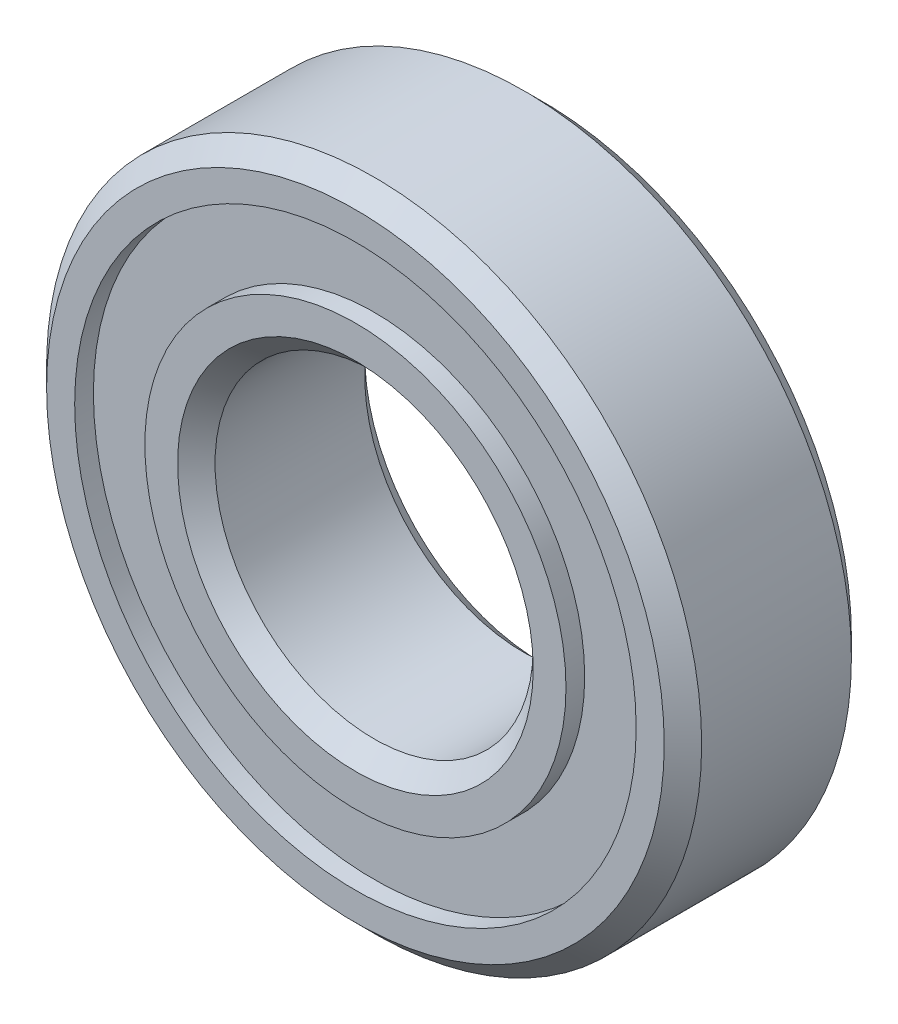
from build123d import *

# Parameters (mm, degrees)
SKETCH1_R           = 17.5
SKETCH1_R_2         = 8.5
BOSS_EXTRUDE1_DEPTH = 5
SKETCH2_R           = 15
SKETCH2_R_2         = 11.25
CUT_EXTRUDE1_DEPTH  = 1
CHAMFER1_SIZE       = 1


with BuildPart() as part:
    # Sketch1 → Boss-Extrude1 (new, symmetric)
    with BuildSketch(Plane.XY):
        Circle(SKETCH1_R)
        Circle(SKETCH1_R_2, mode=Mode.SUBTRACT)
    extrude(amount=BOSS_EXTRUDE1_DEPTH, both=True)

    # Sketch2 → Cut-Extrude1 (cut)
    with BuildSketch(Plane.XY.offset(5)):
        Circle(SKETCH2_R)
        Circle(SKETCH2_R_2, mode=Mode.SUBTRACT)
    cut_extrude1 = extrude(amount=-CUT_EXTRUDE1_DEPTH, mode=Mode.SUBTRACT)

    # Mirror1: Cut-Extrude1 across plane
    add(cut_extrude1.mirror(Plane.XY), mode=Mode.SUBTRACT)

    # Chamfer1
    chamfer1_edges = [part.edges().sort_by_distance(p)[0] for p in [
        (-8.5, 0, -5),
        (-8.5, 0, 5),
        (-17.5, 0, -5),
        (-17.5, 0, 5),
    ]]
    chamfer(chamfer1_edges, length=CHAMFER1_SIZE)


solid = part.part
